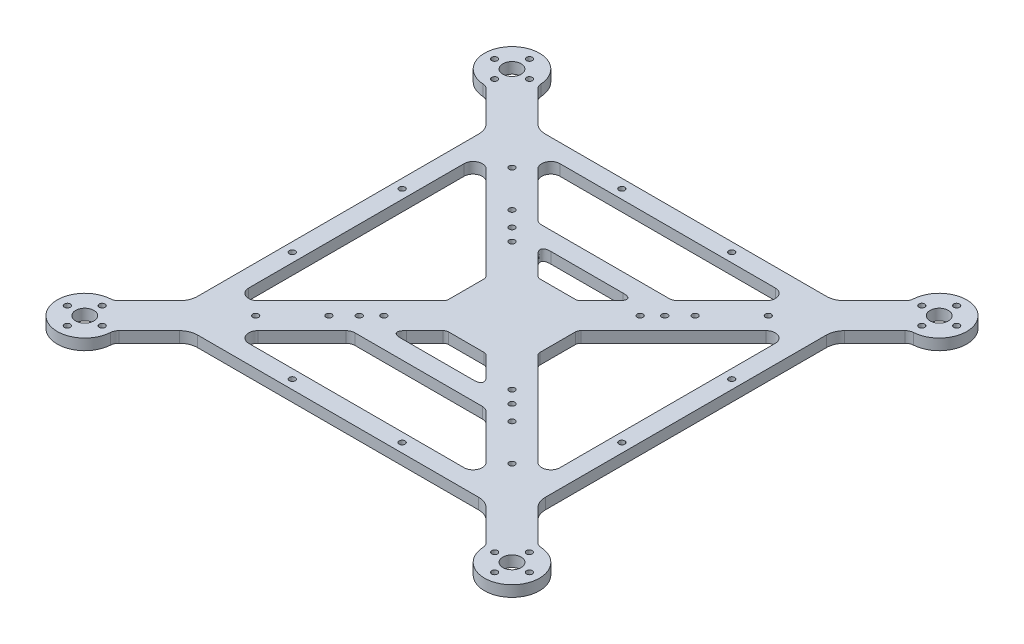
from build123d import *
from OCP.BRepAlgoAPI import BRepAlgoAPI_Cut
from OCP.TopTools import TopTools_ListOfShape

# Parameters (mm, degrees)
SKETCH_4_R          = 1.6
SKETCH_4_R_2        = 5
EXTRUDE_2_DEPTH     = 6
EXTRUDE_3_DEPTH     = 6
FILLET_3_R          = 5
FILLET_4_R          = 5
SKETCH_9_R          = 1.6
CUT_EXTRUDE_3_DEPTH = 187.309841897
CUT_EXTRUDE_5_DEPTH = 187.309841897
SKETCH_13_W         = 50
SKETCH_13_H         = 50
EXTRUDE_5_DEPTH     = 6
FILLET_5_R          = 3
SKETCH_14_R         = 1.6
CUT_EXTRUDE_6_DEPTH = 187.309841897
SKETCH_15_R         = 1.6
CUT_EXTRUDE_7_DEPTH = 187.309841897
SKETCH_16_R         = 1.6
CUT_EXTRUDE_8_DEPTH = 187.309841897
SKETCH_17_R         = 1.6
CUT_EXTRUDE_9_DEPTH = 187.309841897


with BuildPart() as part:
    # 草图4 → 凸台-拉伸2 (new body)
    with BuildSketch(Plane(origin=(0, 0, 0), x_dir=(1, 0, 0), z_dir=(0, 1, 0))):
        with BuildLine():
            Line((-83.786796564, 97.928932188), (-101.695856933, 115.837992557))
            ThreePointArc((-101.695856933, 115.837992557), (-127.279220614, 127.279220614), (-115.837992557, 101.695856933))
            Line((-115.837992557, 101.695856933), (-97.928932188, 83.786796564))
            ThreePointArc((-97.928932188, 83.786796564), (-95.761204675, 80.542563076), (-95, 76.715728753))
            Line((-95, 76.715728753), (-95, -76.715728753))
            ThreePointArc((-95, -76.715728753), (-95.761204675, -80.542563076), (-97.928932188, -83.786796564))
            Line((-97.928932188, -83.786796564), (-115.837992557, -101.695856933))
            ThreePointArc((-115.837992557, -101.695856933), (-127.279220614, -127.279220614), (-101.695856933, -115.837992557))
            Line((-101.695856933, -115.837992557), (-83.786796564, -97.928932188))
            ThreePointArc((-83.786796564, -97.928932188), (-80.542563076, -95.761204675), (-76.715728753, -95))
            Line((-76.715728753, -95), (76.715728753, -95))
            ThreePointArc((76.715728753, -95), (80.542563076, -95.761204675), (83.786796564, -97.928932188))
            Line((83.786796564, -97.928932188), (101.695856933, -115.837992557))
            ThreePointArc((101.695856933, -115.837992557), (127.279220614, -127.279220614), (115.837992557, -101.695856933))
            Line((115.837992557, -101.695856933), (97.928932188, -83.786796564))
            ThreePointArc((97.928932188, -83.786796564), (95.761204675, -80.542563076), (95, -76.715728753))
            Line((95, -76.715728753), (95, 76.715728753))
            ThreePointArc((95, 76.715728753), (95.761204675, 80.542563076), (97.928932188, 83.786796564))
            Line((97.928932188, 83.786796564), (115.837992557, 101.695856933))
            ThreePointArc((115.837992557, 101.695856933), (127.279220614, 127.279220614), (101.695856933, 115.837992557))
            Line((101.695856933, 115.837992557), (83.786796564, 97.928932188))
            ThreePointArc((83.786796564, 97.928932188), (80.542563076, 95.761204675), (76.715728753, 95))
            Line((76.715728753, 95), (-76.715728753, 95))
            ThreePointArc((-76.715728753, 95), (-80.542563076, 95.761204675), (-83.786796564, 97.928932188))
        make_face()
        with BuildLine():
            Line((58.786796564, -85), (-58.786796564, -85))
            ThreePointArc((-58.786796564, -85), (-63.406194227, -81.913417162), (-62.32233047, -76.464466094))
            Line((-62.32233047, -76.464466094), (-3.535533906, -17.67766953))
            ThreePointArc((-3.535533906, -17.67766953), (0, -16.213203436), (3.535533906, -17.67766953))
            Line((3.535533906, -17.67766953), (62.32233047, -76.464466094))
            ThreePointArc((62.32233047, -76.464466094), (63.406194227, -81.913417162), (58.786796564, -85))
        make_face(mode=Mode.SUBTRACT)
        with BuildLine():
            Line((-85, -58.786796564), (-85, 58.786796564))
            ThreePointArc((-85, 58.786796564), (-81.913417162, 63.406194227), (-76.464466094, 62.32233047))
            Line((-76.464466094, 62.32233047), (-17.67766953, 3.535533906))
            ThreePointArc((-17.67766953, 3.535533906), (-16.213203436, 0), (-17.67766953, -3.535533906))
            Line((-17.67766953, -3.535533906), (-76.464466094, -62.32233047))
            ThreePointArc((-76.464466094, -62.32233047), (-81.913417162, -63.406194227), (-85, -58.786796564))
        make_face(mode=Mode.SUBTRACT)
        with BuildLine():
            Line((85, 58.786796564), (85, -58.786796564))
            ThreePointArc((85, -58.786796564), (81.913417162, -63.406194227), (76.464466094, -62.32233047))
            Line((76.464466094, -62.32233047), (17.67766953, -3.535533906))
            ThreePointArc((17.67766953, -3.535533906), (16.213203436, 0), (17.67766953, 3.535533906))
            Line((17.67766953, 3.535533906), (76.464466094, 62.32233047))
            ThreePointArc((76.464466094, 62.32233047), (81.913417162, 63.406194227), (85, 58.786796564))
        make_face(mode=Mode.SUBTRACT)
        with BuildLine():
            Line((-58.786796564, 85), (58.786796564, 85))
            ThreePointArc((58.786796564, 85), (63.406194227, 81.913417162), (62.32233047, 76.464466094))
            Line((62.32233047, 76.464466094), (3.535533906, 17.67766953))
            ThreePointArc((3.535533906, 17.67766953), (0, 16.213203436), (-3.535533906, 17.67766953))
            Line((-3.535533906, 17.67766953), (-62.32233047, 76.464466094))
            ThreePointArc((-62.32233047, 76.464466094), (-63.406194227, 81.913417162), (-58.786796564, 85))
        make_face(mode=Mode.SUBTRACT)
        with Locations(Location((-107.172618896, 116.672618896, 0), (0, 0, 270))):
            Circle(SKETCH_4_R, mode=Mode.SUBTRACT)
        with Locations(Location((-116.672618896, 107.172618896, 0), (0, 0, 270))):
            Circle(SKETCH_4_R, mode=Mode.SUBTRACT)
        with Locations(Location((-126.172618896, 116.672618896, 0), (0, 0, 270))):
            Circle(SKETCH_4_R, mode=Mode.SUBTRACT)
        with Locations(Location((-116.672618896, 116.672618896, 0), (0, 0, 270))):
            Circle(SKETCH_4_R_2, mode=Mode.SUBTRACT)
        with Locations(Location((-116.672618896, 126.172618896, 0), (0, 0, 270))):
            Circle(SKETCH_4_R, mode=Mode.SUBTRACT)
        with Locations(Location((-116.672618896, -107.172618896, 0), (0, 0, 270))):
            Circle(SKETCH_4_R, mode=Mode.SUBTRACT)
        with Locations(Location((-116.672618896, -126.172618896, 0), (0, 0, 270))):
            Circle(SKETCH_4_R, mode=Mode.SUBTRACT)
        with Locations(Location((-126.172618896, -116.672618896, 0), (0, 0, 270))):
            Circle(SKETCH_4_R, mode=Mode.SUBTRACT)
        with Locations(Location((-116.672618896, -116.672618896, 0), (0, 0, 270))):
            Circle(SKETCH_4_R_2, mode=Mode.SUBTRACT)
        with Locations(Location((-107.172618896, -116.672618896, 0), (0, 0, 270))):
            Circle(SKETCH_4_R, mode=Mode.SUBTRACT)
        with Locations(Location((116.672618896, 126.172618896, 0), (0, 0, 270))):
            Circle(SKETCH_4_R, mode=Mode.SUBTRACT)
        with Locations(Location((116.672618896, 107.172618896, 0), (0, 0, 270))):
            Circle(SKETCH_4_R, mode=Mode.SUBTRACT)
        with Locations(Location((107.172618896, 116.672618896, 0), (0, 0, 270))):
            Circle(SKETCH_4_R, mode=Mode.SUBTRACT)
        with Locations(Location((116.672618896, 116.672618896, 0), (0, 0, 270))):
            Circle(SKETCH_4_R_2, mode=Mode.SUBTRACT)
        with Locations(Location((126.172618896, 116.672618896, 0), (0, 0, 270))):
            Circle(SKETCH_4_R, mode=Mode.SUBTRACT)
        with Locations(Location((116.672618896, -107.172618896, 0), (0, 0, 270))):
            Circle(SKETCH_4_R, mode=Mode.SUBTRACT)
        with Locations(Location((107.172618896, -116.672618896, 0), (0, 0, 270))):
            Circle(SKETCH_4_R, mode=Mode.SUBTRACT)
        with Locations(Location((116.672618896, -126.172618896, 0), (0, 0, 270))):
            Circle(SKETCH_4_R, mode=Mode.SUBTRACT)
        with Locations(Location((116.672618896, -116.672618896, 0), (0, 0, 270))):
            Circle(SKETCH_4_R_2, mode=Mode.SUBTRACT)
        with Locations(Location((126.172618896, -116.672618896, 0), (0, 0, 270))):
            Circle(SKETCH_4_R, mode=Mode.SUBTRACT)
    extrude(amount=EXTRUDE_2_DEPTH)

    # 草图6 → 凸台-拉伸3 (add)
    with BuildSketch(Plane(origin=(0, 6, 0), x_dir=(1, 0, 0), z_dir=(0, 1, 0))):
        Polygon((-51, 36.857864376), (-41, 26.857864376), (-41, -26.857864376), (-51, -36.857864376), align=None)
        Polygon((41, -26.857864376), (41, 26.857864376), (51, 36.857864376), (51, -36.857864376), align=None)
        Polygon((36.857864376, 51), (26.857864376, 41), (-26.857864376, 41), (-36.857864376, 51), align=None)
        Polygon((-26.857864376, -41), (26.857864376, -41), (36.857864376, -51), (-36.857864376, -51), align=None)
    extrude(amount=-EXTRUDE_3_DEPTH)

    # 圆角2
    # a fillet whose section is not a circle: 3 mm, written as the material it adds along each edge (its section moved 0.00015 mm through the faces so that the kernel can cut it)
    with BuildSketch(Plane(origin=(41, 6, -26.857864376), x_dir=(-0.7071214256958381, 0, 0.7070921363739562), z_dir=(0, -1, 0)), Plane(origin=(-41, 6, 26.857864376), x_dir=(0.7071214256958381, 0, -0.7070921363739561), z_dir=(0, -1, 0))) as fillet_2_piece_1:
        with BuildLine():
            add(Edge.make_bspline([(7.242640689, 0), (6.248372346, 2.0592e-05), (5.254104003, 4.1184e-05), (3.232361258, -0.6134697), (2.719336442, -1.85194862), (3.715029555, -3.715395576), (4.418068881, -4.418464024), (5.121108208, -5.121532472)], knots=[0, 0, 0, 0, 0, 0, 0.5, 0.5, 1, 1, 1, 1, 1, 1], degree=5))
            Line((5.121108208, -5.121532472), (5.078680923, -5.163958))
            ThreePointArc((5.078680923, -5.163958), (2.518179853, -2.603138732), (-0.042427286, -0.042425528))
            Line((-0.042427286, -0.042425528), (1.243e-06, 0.06))
            ThreePointArc((1.243e-06, 0.06), (3.621321585, 0.059925), (7.242641931, 0.06))
            Line((7.242641931, 0.06), (7.242640689, 0))
        make_face()
    extrude(amount=6)
    with BuildSketch(Plane(origin=(41, 6, 26.857864376), x_dir=(-0.7071214256958276, 0, -0.7070921363739666), z_dir=(0, -1, 0)), Plane(origin=(-41, 6, -26.857864376), x_dir=(0.7071214256958339, 0, 0.7070921363739603), z_dir=(0, -1, 0)), Plane(origin=(26.857864376, 6, -41), x_dir=(-0.7070921363739617, 0, 0.7071214256958324), z_dir=(0, -1, 0))) as fillet_2_piece_2:
        with BuildLine():
            add(Edge.make_bspline([(7.242640689, 0), (6.248372346, -2.0592e-05), (5.254104003, -4.1184e-05), (3.232361258, 0.6134697), (2.719336442, 1.85194862), (3.715029555, 3.715395576), (4.418068881, 4.418464024), (5.121108208, 5.121532472)], knots=[0, 0, 0, 0, 0, 0, 0.5, 0.5, 1, 1, 1, 1, 1, 1], degree=5))
            Line((5.121108208, 5.121532472), (5.078680923, 5.163958))
            ThreePointArc((5.078680923, 5.163958), (2.518179853, 2.603138732), (-0.042427286, 0.042425528))
            Line((-0.042427286, 0.042425528), (1.243e-06, -0.06))
            ThreePointArc((1.243e-06, -0.06), (3.621321585, -0.059925), (7.242641931, -0.06))
            Line((7.242641931, -0.06), (7.242640689, 0))
        make_face()
    extrude(amount=6)
    with BuildSketch(Plane(origin=(26.857864376, 6, 41), x_dir=(-0.7070921363739594, 0, -0.7071214256958349), z_dir=(0, -1, 0)), Plane(origin=(-26.857864376, 6, -41), x_dir=(0.7070921363739636, 0, 0.7071214256958305), z_dir=(0, -1, 0))) as fillet_2_piece_3:
        with BuildLine():
            add(Edge.make_bspline([(7.242640689, 0), (6.248372346, 2.0592e-05), (5.254104003, 4.1184e-05), (3.232361258, -0.6134697), (2.719336442, -1.85194862), (3.715029555, -3.715395576), (4.418068881, -4.418464024), (5.121108208, -5.121532472)], knots=[0, 0, 0, 0, 0, 0, 0.5, 0.5, 1, 1, 1, 1, 1, 1], degree=5))
            Line((5.121108208, -5.121532472), (5.078680923, -5.163958))
            ThreePointArc((5.078680923, -5.163958), (2.518179853, -2.603138732), (-0.042427286, -0.042425528))
            Line((-0.042427286, -0.042425528), (1.243e-06, 0.06))
            ThreePointArc((1.243e-06, 0.06), (3.621321585, 0.059925), (7.242641931, 0.06))
            Line((7.242641931, 0.06), (7.242640689, 0))
        make_face()
    extrude(amount=6)
    with BuildSketch(Plane(origin=(-26.857864376, 6, 41), x_dir=(0.7070921363739483, 0, -0.707121425695846), z_dir=(0, -1, 0))) as fillet_2_piece_4:
        with BuildLine():
            add(Edge.make_bspline([(7.242640689, 0), (6.248372346, -2.0592e-05), (5.254104003, -4.1184e-05), (3.232361258, 0.6134697), (2.719336442, 1.85194862), (3.715029555, 3.715395576), (4.418068881, 4.418464024), (5.121108208, 5.121532472)], knots=[0, 0, 0, 0, 0, 0, 0.5, 0.5, 1, 1, 1, 1, 1, 1], degree=5))
            Line((5.121108208, 5.121532472), (5.078680923, 5.163958))
            ThreePointArc((5.078680923, 5.163958), (2.518179853, 2.603138732), (-0.042427286, 0.042425528))
            Line((-0.042427286, 0.042425528), (1.243e-06, -0.06))
            ThreePointArc((1.243e-06, -0.06), (3.621321585, -0.059925), (7.242641931, -0.06))
            Line((7.242641931, -0.06), (7.242640689, 0))
        make_face()
    extrude(amount=6)

    # 圆角3
    fillet_3_edges = [part.edges().sort_by_distance(p)[0] for p in [
        (-51, 3, 36.857864376),
        (-51, 3, -36.857864376),
        (51, 3, -36.857864376),
        (51, 3, 36.857864376),
        (-36.857864376, 3, -51),
        (36.857864376, 3, -51),
        (36.857864376, 3, 51),
        (-36.857864376, 3, 51),
    ]]
    fillet(fillet_3_edges, radius=FILLET_3_R)

    # 圆角4
    fillet_4_edges = [part.edges().sort_by_distance(p)[0] for p in [
        (-115.837992557, 3, -101.695856933),
        (-101.695856933, 3, -115.837992557),
        (101.695856933, 3, -115.837992557),
        (115.837992557, 3, -101.695856933),
        (115.837992557, 3, 101.695856933),
        (101.695856933, 3, 115.837992557),
        (-101.695856933, 3, 115.837992557),
        (-115.837992557, 3, 101.695856933),
    ]]
    fillet(fillet_4_edges, radius=FILLET_4_R)

    # 草图9 → 切除-拉伸3 (cut, through all)
    with BuildSketch(Plane(origin=(0, 6, 0), x_dir=(1, 0, 0), z_dir=(0, 1, 0))):
        with Locations(Location((-35, 35, 0), (0, 0, 270))):
            Circle(SKETCH_9_R)
        with Locations(Location((35, 35, 0), (0, 0, 270))):
            Circle(SKETCH_9_R)
        with Locations(Location((-35, -35, 0), (0, 0, 270))):
            Circle(SKETCH_9_R)
        with Locations(Location((35, -35, 0), (0, 0, 270))):
            Circle(SKETCH_9_R)
    extrude(amount=-CUT_EXTRUDE_3_DEPTH, mode=Mode.SUBTRACT)


with BuildPart() as cut_extrude_5_tool:
    # 草图12 → 切除-拉伸5 (new, through all)
    with BuildSketch(Plane(origin=(0, 6, 0), x_dir=(1, 0, 0), z_dir=(0, 1, 0))):
        with BuildLine():
            Line((-35.878679656, 21.736544033), (-52.464466094, 38.32233047))
            ThreePointArc((-52.464466094, 38.32233047), (-51.380602337, 36.700213726), (-51, 34.786796564))
            Line((-51, 34.786796564), (-51, -34.786796564))
            ThreePointArc((-51, -34.786796564), (-51.380602337, -36.700213726), (-52.464466094, -38.32233047))
            Line((-52.464466094, -38.32233047), (-35.878679656, -21.736544033))
            add(Edge.make_bspline(
                [(-35.878679656, -21.736544033), (-36.377956308, -22.235820684), (-36.666691175, -22.4858944), (-37.116009159, -22.875049402), (-37.543731335, -23.130210009), (-38.064823265, -23.441070983), (-38.543804211, -23.553963378), (-39.152152823, -23.69734681), (-39.617258255, -23.502018307), (-40.080888284, -23.307309422), (-40.407020418, -22.774395871), (-40.66343883, -22.355397457), (-40.810450648, -21.768727666), (-40.930647118, -21.28906801), (-40.972750848, -20.701069283), (-41, -20.320521848), (-41, -19.615223689)],
                knots=[0, 0, 0, 0.125, 0.125, 0.25, 0.25, 0.375, 0.375, 0.5, 0.5, 0.625, 0.625, 0.75, 0.75, 0.875, 0.875, 1, 1, 1], degree=2))
            Line((-41, -19.615223689), (-41, 19.615223689))
            add(Edge.make_bspline(
                [(-41, 19.615223689), (-41, 20.321307501), (-40.972662438, 20.702302704), (-40.930120786, 21.295192638), (-40.808101329, 21.778063685), (-40.659445596, 22.366343225), (-40.400581899, 22.784860878), (-40.071801867, 23.316415703), (-39.604804552, 23.507176799), (-39.139288642, 23.697332765), (-38.531851613, 23.551116222), (-38.054259795, 23.4361548), (-37.535468554, 23.125269666), (-37.111306219, 22.871090809), (-36.665756499, 22.485084756), (-36.377400767, 22.235265143), (-35.878679656, 21.736544033)],
                knots=[0, 0, 0, 0.125, 0.125, 0.25, 0.25, 0.375, 0.375, 0.5, 0.5, 0.625, 0.625, 0.75, 0.75, 0.875, 0.875, 1, 1, 1], degree=2))
        make_face()
        with BuildLine():
            Line((51, -34.786796564), (51, 34.786796564))
            ThreePointArc((51, 34.786796564), (51.380602337, 36.700213726), (52.464466094, 38.32233047))
            Line((52.464466094, 38.32233047), (35.878679656, 21.736544033))
            add(Edge.make_bspline(
                [(41, 19.615223689), (41, 20.321307501), (40.972662438, 20.702302704), (40.930120786, 21.295192638), (40.808101329, 21.778063685), (40.659445596, 22.366343225), (40.400581899, 22.784860878), (40.071801867, 23.316415703), (39.604804552, 23.507176799), (39.139288642, 23.697332765), (38.531851613, 23.551116222), (38.054259795, 23.4361548), (37.535468554, 23.125269666), (37.111306219, 22.871090809), (36.665756499, 22.485084756), (36.377400767, 22.235265143), (35.878679656, 21.736544033)],
                knots=[0, 0, 0, 0.125, 0.125, 0.25, 0.25, 0.375, 0.375, 0.5, 0.5, 0.625, 0.625, 0.75, 0.75, 0.875, 0.875, 1, 1, 1], degree=2))
            Line((41, 19.615223689), (41, -19.615223689))
            add(Edge.make_bspline(
                [(35.878679656, -21.736544033), (36.377956308, -22.235820684), (36.666691175, -22.4858944), (37.116009159, -22.875049402), (37.543731335, -23.130210009), (38.064823265, -23.441070983), (38.543804211, -23.553963378), (39.152152823, -23.69734681), (39.617258255, -23.502018307), (40.080888284, -23.307309422), (40.407020418, -22.774395871), (40.66343883, -22.355397457), (40.810450648, -21.768727666), (40.930647118, -21.28906801), (40.972750848, -20.701069283), (41, -20.320521848), (41, -19.615223689)],
                knots=[0, 0, 0, 0.125, 0.125, 0.25, 0.25, 0.375, 0.375, 0.5, 0.5, 0.625, 0.625, 0.75, 0.75, 0.875, 0.875, 1, 1, 1], degree=2))
            Line((35.878679656, -21.736544033), (52.464466094, -38.32233047))
            ThreePointArc((52.464466094, -38.32233047), (51.380602337, -36.700213726), (51, -34.786796564))
        make_face()
    extrude(amount=-CUT_EXTRUDE_5_DEPTH)


with BuildPart() as part_1:
    add(part.part)

    # 切除-拉伸5: cut by cut_extrude_5_tool, with a tolerance
    cut_extrude_5_stock = TopTools_ListOfShape()
    cut_extrude_5_stock.Append(part_1.part.wrapped)
    cut_extrude_5_tools = TopTools_ListOfShape()
    cut_extrude_5_tools.Append(cut_extrude_5_tool.part.wrapped)
    cut_extrude_5_cut = BRepAlgoAPI_Cut()
    cut_extrude_5_cut.SetArguments(cut_extrude_5_stock)
    cut_extrude_5_cut.SetTools(cut_extrude_5_tools)
    cut_extrude_5_cut.SetFuzzyValue(0.00001)
    cut_extrude_5_cut.Build()
    add(Compound.cast(cut_extrude_5_cut.Shape()).solids(), mode=Mode.REPLACE)


with BuildPart() as cut_extrude_5_kept_piece:
    # of the separate pieces the step leaves, the one the design keeps (cut_extrude_5_pieces_kept)
    add(part_1.part.solids().sort_by_distance((100.247407617, 0, -114.389543241))[0])

    # 草图13 → 凸台-拉伸5 (add)
    with BuildSketch(Plane(origin=(0, 6, 0), x_dir=(1, 0, 0), z_dir=(0, 1, 0))):
        Rectangle(SKETCH_13_W, SKETCH_13_H)
    extrude(amount=-EXTRUDE_5_DEPTH)

    # 圆角5
    fillet_5_edges = [cut_extrude_5_kept_piece.edges().sort_by_distance(p)[0] for p in [
        (-10.857864376, 3, -25),
        (10.857864376, 3, -25),
        (25, 3, -10.857864376),
        (25, 3, 10.857864376),
        (10.857864376, 3, 25),
        (-10.857864376, 3, 25),
        (-25, 3, 10.857864376),
        (-25, 3, -10.857864376),
    ]]
    fillet(fillet_5_edges, radius=FILLET_5_R)

    # 草图14 → 切除-拉伸6 (cut, through all)
    with BuildSketch(Plane(origin=(0, 6, 0), x_dir=(1, 0, 0), z_dir=(0, 1, 0))):
        with Locations(Location((-50, 50, 0), (0, 0, 270))):
            Circle(SKETCH_14_R)
        with Locations(Location((50, 50, 0), (0, 0, 270))):
            Circle(SKETCH_14_R)
        with Locations(Location((50, -50, 0), (0, 0, 270))):
            Circle(SKETCH_14_R)
        with Locations(Location((-50, -50, 0), (0, 0, 270))):
            Circle(SKETCH_14_R)
    extrude(amount=-CUT_EXTRUDE_6_DEPTH, mode=Mode.SUBTRACT)

    # 草图15 → 切除-拉伸7 (cut, through all)
    with BuildSketch(Plane(origin=(0, 6, 0), x_dir=(1, 0, 0), z_dir=(0, 1, 0))):
        with Locations(Location((-30, 90, 0), (0, 0, 270))):
            Circle(SKETCH_15_R)
        with Locations(Location((30, 90, 0), (0, 0, 270))):
            Circle(SKETCH_15_R)
        with Locations(Location((90, 30, 0), (0, 0, 270))):
            Circle(SKETCH_15_R)
        with Locations(Location((30, -90, 0), (0, 0, 270))):
            Circle(SKETCH_15_R)
        with Locations(Location((-90, -30, 0), (0, 0, 270))):
            Circle(SKETCH_15_R)
        with Locations(Location((90, -30, 0), (0, 0, 270))):
            Circle(SKETCH_15_R)
        with Locations(Location((-30, -90, 0), (0, 0, 270))):
            Circle(SKETCH_15_R)
        with Locations(Location((-90, 30, 0), (0, 0, 270))):
            Circle(SKETCH_15_R)
    extrude(amount=-CUT_EXTRUDE_7_DEPTH, mode=Mode.SUBTRACT)

    # 草图16 → 切除-拉伸8 (cut, through all)
    with BuildSketch(Plane(origin=(0, 6, 0), x_dir=(1, 0, 0), z_dir=(0, 1, 0))):
        with Locations(Location((-70, 70, 0), (0, 0, 270))):
            Circle(SKETCH_16_R)
        with Locations(Location((70, 70, 0), (0, 0, 270))):
            Circle(SKETCH_16_R)
        with Locations(Location((70, -70, 0), (0, 0, 270))):
            Circle(SKETCH_16_R)
        with Locations(Location((-70, -70, 0), (0, 0, 270))):
            Circle(SKETCH_16_R)
    extrude(amount=-CUT_EXTRUDE_8_DEPTH, mode=Mode.SUBTRACT)

    # 草图17 → 切除-拉伸9 (cut, through all)
    with BuildSketch(Plane(origin=(0, 6, 0), x_dir=(1, 0, 0), z_dir=(0, 1, 0))):
        with Locations(Location((-41.715728753, 41.715728753, 0), (0, 0, 270))):
            Circle(SKETCH_17_R)
        with Locations(Location((41.715728753, 41.715728753, 0), (0, 0, 270))):
            Circle(SKETCH_17_R)
        with Locations(Location((41.715728753, -41.715728753, 0), (0, 0, 270))):
            Circle(SKETCH_17_R)
        with Locations(Location((-41.715728753, -41.715728753, 0), (0, 0, 270))):
            Circle(SKETCH_17_R)
    extrude(amount=-CUT_EXTRUDE_9_DEPTH, mode=Mode.SUBTRACT)


solid = cut_extrude_5_kept_piece.part
